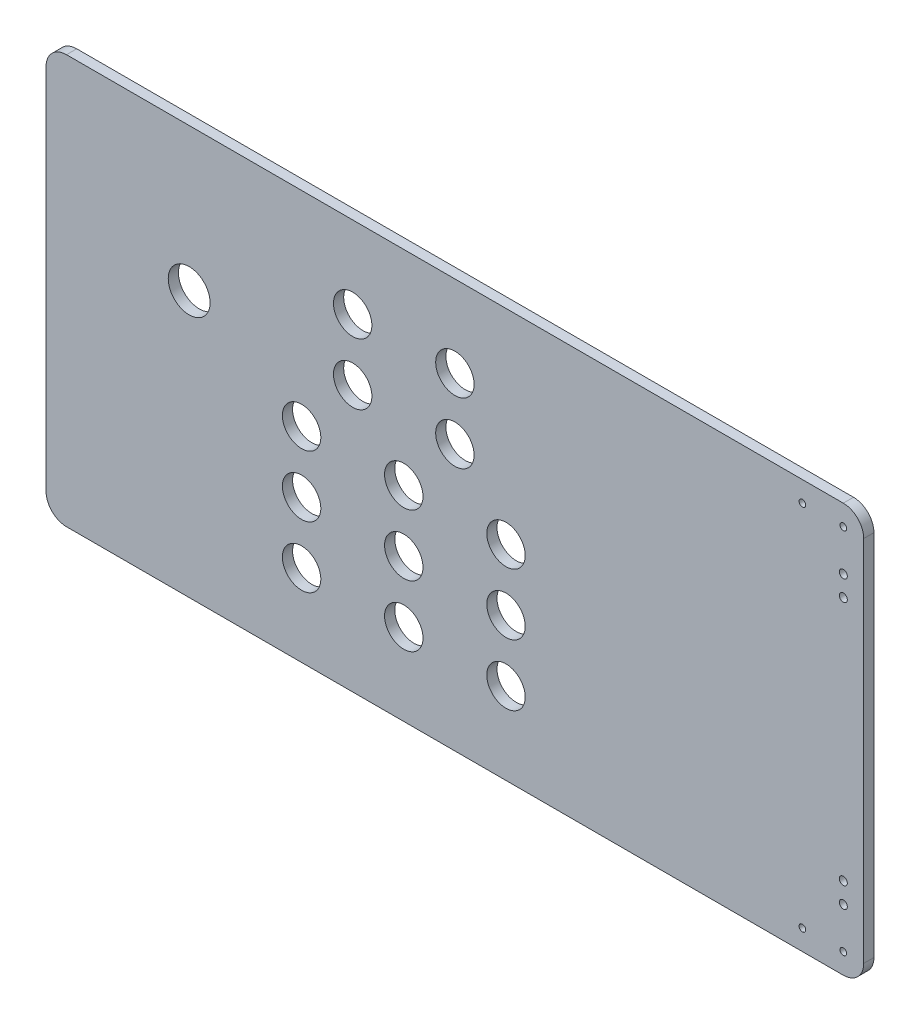
from build123d import *

# Parameters (mm, degrees)
SKETCH1_W           = 508
SKETCH1_H           = 254
BOSS_EXTRUDE1_DEPTH = 6.35
SKETCH3_R           = 11.938
SKETCH3_R_2         = 13
CUT_EXTRUDE2_DEPTH  = 568.996762755
FILLET1_R           = 12.7
SKETCH4_R           = 2.0701
SKETCH4_R_2         = 2.4892
CUT_EXTRUDE3_DEPTH  = 568.996762755


with BuildPart() as part:
    # Sketch1 → Boss-Extrude1 (new body)
    with BuildSketch(Plane.XY):
        with Locations((254, 127)):
            Rectangle(SKETCH1_W, SKETCH1_H)
    extrude(amount=BOSS_EXTRUDE1_DEPTH)

    # Sketch3 → Cut-Extrude2 (cut, through all)
    with BuildSketch(Plane(origin=(0, 0, 0), x_dir=(-1, 0, 0), z_dir=(0, 0, -1))):
        with Locations((-158.75, 88.9)):
            Circle(SKETCH3_R)
        with Locations((-222.25, 88.9)):
            Circle(SKETCH3_R)
        with Locations((-158.75, 50.8)):
            Circle(SKETCH3_R)
        with Locations((-222.25, 50.8)):
            Circle(SKETCH3_R)
        with Locations((-222.25, 127)):
            Circle(SKETCH3_R)
        with Locations((-285.75, 127)):
            Circle(SKETCH3_R)
        with Locations((-285.75, 88.9)):
            Circle(SKETCH3_R)
        with Locations((-285.75, 50.8)):
            Circle(SKETCH3_R)
        with Locations((-254, 203.2)):
            Circle(SKETCH3_R)
        with Locations((-190.5, 203.2)):
            Circle(SKETCH3_R)
        with Locations((-158.75, 127)):
            Circle(SKETCH3_R)
        with Locations((-190.5, 165.1)):
            Circle(SKETCH3_R)
        with Locations((-254, 165.1)):
            Circle(SKETCH3_R)
        with Locations((-88.9, 165.1)):
            Circle(SKETCH3_R_2)
    extrude(amount=-CUT_EXTRUDE2_DEPTH, mode=Mode.SUBTRACT)

    # Fillet1
    fillet1_edges = [part.edges().sort_by_distance(p)[0] for p in [
        (508, 0, 3.175),
        (0, 0, 3.175),
        (0, 254, 3.175),
        (508, 254, 3.175),
    ]]
    fillet(fillet1_edges, radius=FILLET1_R)

    # Sketch4 → Cut-Extrude3 (cut, through all)
    with BuildSketch(Plane(origin=(0, 0, 0), x_dir=(-1, 0, 0), z_dir=(0, 0, -1))):
        with Locations((-495.320545376, 241.3)):
            Circle(SKETCH4_R)
        with Locations((-469.920545376, 241.3)):
            Circle(SKETCH4_R)
        with Locations((-495.320545376, 215.9)):
            Circle(SKETCH4_R_2)
        with Locations((-495.320545376, 203.2)):
            Circle(SKETCH4_R_2)
        with Locations((-469.920545376, 12.7)):
            Circle(SKETCH4_R)
        with Locations((-495.320545376, 50.8)):
            Circle(SKETCH4_R_2)
        with Locations((-495.320545376, 38.1)):
            Circle(SKETCH4_R_2)
        with Locations((-495.320545376, 12.7)):
            Circle(SKETCH4_R)
    extrude(amount=-CUT_EXTRUDE3_DEPTH, mode=Mode.SUBTRACT)


solid = part.part
